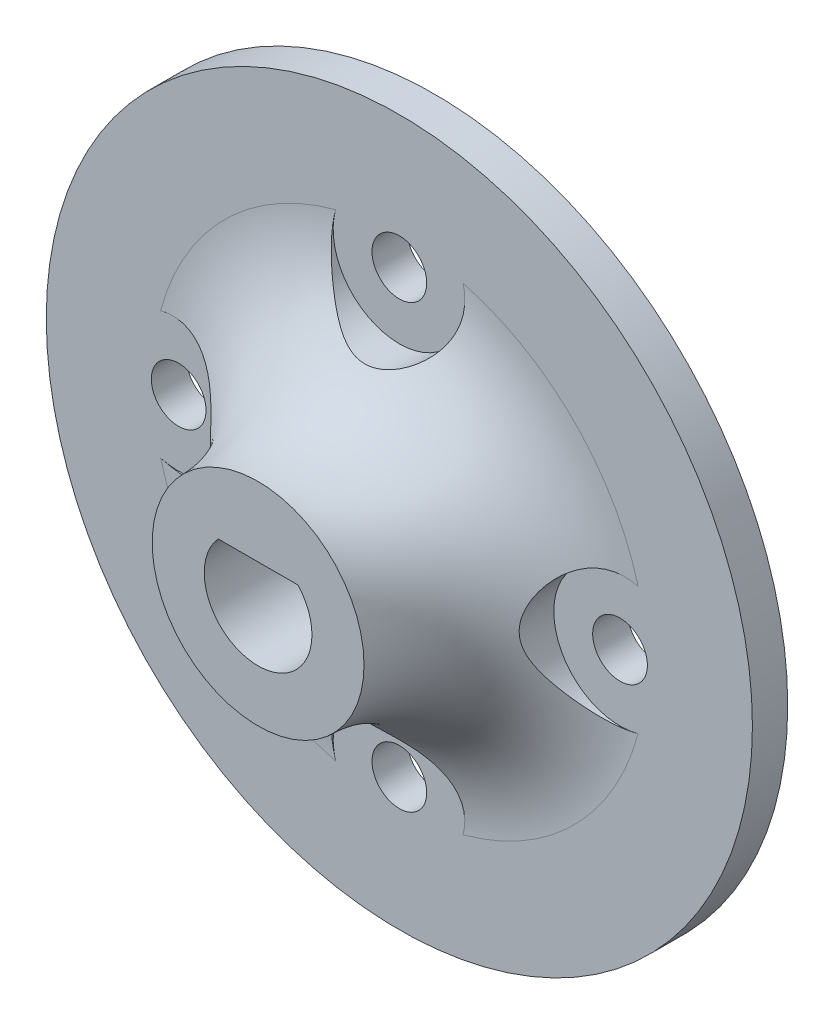
from build123d import *

# Parameters (mm, degrees)
ESBO_O1_R                = 20
RESSALTO_EXTRUS_O1_DEPTH = 2
ESBO_O2_R                = 6
RESSALTO_EXTRUS_O2_DEPTH = 8
FILETE3_R                = 8
ESBO_O3_R                = 1.55
CORTE_EXTRUS_O1_DEPTH    = 30.393876913
PADR_OCIRCULAR1_COUNT    = 4
ESBO_O5_R                = 3.75
CORTE_EXTRUS_O2_DEPTH    = 6
PADR_OCIRCULAR2_COUNT    = 4


with BuildPart() as part:
    # Esboço1 → Ressalto-extrusão1 (new body)
    with BuildSketch(Plane.XY):
        Circle(ESBO_O1_R)
    extrude(amount=RESSALTO_EXTRUS_O1_DEPTH)

    # Esboço2 → Ressalto-extrusão2 (add)
    with BuildSketch(Plane.XY.offset(2)):
        Circle(ESBO_O2_R)
        with BuildLine():
            Line((-2.258317958, 2.05), (2.258317958, 2.05))
            ThreePointArc((2.258317958, 2.05), (0, -3.05), (-2.258317958, 2.05))
        make_face(mode=Mode.SUBTRACT)
    extrude(amount=RESSALTO_EXTRUS_O2_DEPTH)

    # Filete3
    filete3_edges = [part.edges().sort_by_distance(p)[0] for p in [
        (-6, 0, 2),
    ]]
    fillet(filete3_edges, radius=FILETE3_R - 0.0001)  # a hair under: the kernel refuses the full size

    # Esboço3 → Corte-extrusão1 (cut, through all)
    with BuildSketch(Plane.XY.offset(2)):
        with Locations((0, -12.5)):
            Circle(ESBO_O3_R)
    corte_extrus_o1 = extrude(amount=-CORTE_EXTRUS_O1_DEPTH, mode=Mode.SUBTRACT)

    # PadrãoCircular1: Corte-extrusão1 ×4 about axis
    padr_ocircular1_axis = Axis((0, 0, 0), (0, 0, 1))
    for i in range(1, PADR_OCIRCULAR1_COUNT):
        add(corte_extrus_o1.rotate(padr_ocircular1_axis, i * 360 / PADR_OCIRCULAR1_COUNT), mode=Mode.SUBTRACT)

    # Esboço5 → Corte-extrusão2 (cut)
    with BuildSketch(Plane.XY.offset(2)):
        with Locations((12.5, 0)):
            Circle(ESBO_O5_R)
    corte_extrus_o2 = extrude(amount=CORTE_EXTRUS_O2_DEPTH, mode=Mode.SUBTRACT)

    # PadrãoCircular2: Corte-extrusão2 ×4 about axis
    padr_ocircular2_axis = Axis((0, 0, 0), (0, 0, 1))
    for i in range(1, PADR_OCIRCULAR2_COUNT):
        add(corte_extrus_o2.rotate(padr_ocircular2_axis, i * 360 / PADR_OCIRCULAR2_COUNT), mode=Mode.SUBTRACT)


solid = part.part
